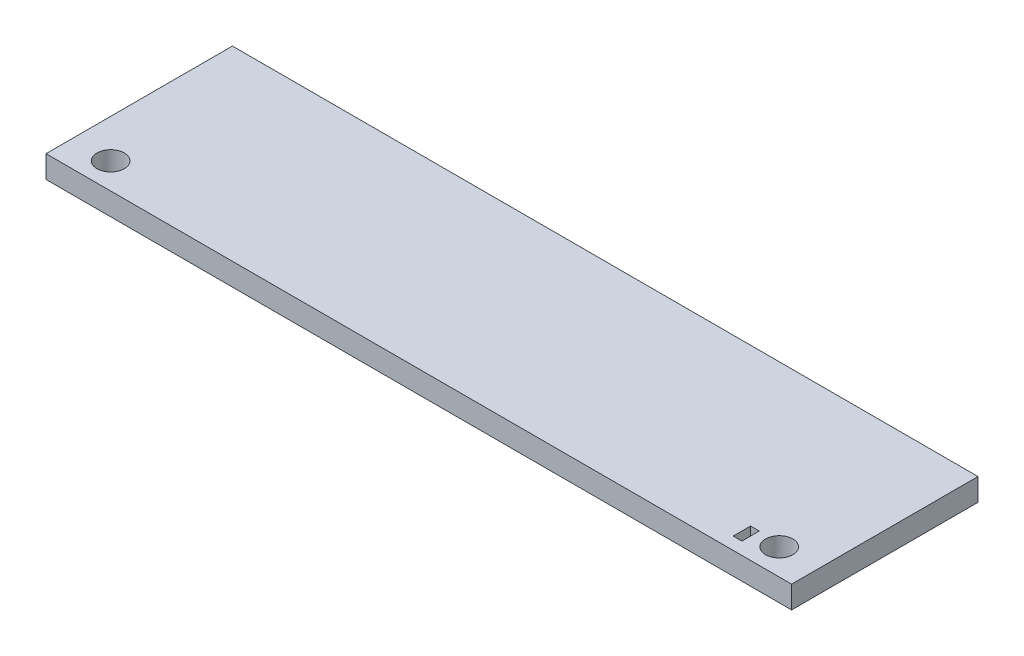
from build123d import *

# Parameters (mm, degrees)
ESQUISSE1_W             = 600
ESQUISSE1_H             = 150
BOSS_EXTRU_1_DEPTH      = 18
ESQUISSE3_R             = 11
ENL_V_MAT_EXTRU_1_DEPTH = 20
ESQUISSE4_W             = 7
ESQUISSE4_H             = 14
ENL_V_MAT_EXTRU_2_DEPTH = 12


with BuildPart() as part:
    # Esquisse1 → Boss.-Extru.1 (new body)
    with BuildSketch(Plane(origin=(0, 0, 0), x_dir=(1, 0, 0), z_dir=(0, 1, 0))):
        Rectangle(ESQUISSE1_W, ESQUISSE1_H)
    extrude(amount=BOSS_EXTRU_1_DEPTH)

    # Esquisse3 → Enlèv. mat.-Extru.1 (cut)
    with BuildSketch(Plane(origin=(0, 18, 0), x_dir=(1, 0, 0), z_dir=(0, 1, 0))):
        with Locations((269, -54)):
            Circle(ESQUISSE3_R)
        with Locations((-269, -54)):
            Circle(ESQUISSE3_R)
    extrude(amount=-ENL_V_MAT_EXTRU_1_DEPTH, mode=Mode.SUBTRACT)

    # Esquisse4 → Enlèv. mat.-Extru.2 (cut)
    with BuildSketch(Plane(origin=(0, 18, 0), x_dir=(1, 0, 0), z_dir=(0, 1, 0))):
        with Locations((246.5, -58)):
            Rectangle(ESQUISSE4_W, ESQUISSE4_H)
    extrude(amount=-ENL_V_MAT_EXTRU_2_DEPTH, mode=Mode.SUBTRACT)


solid = part.part
